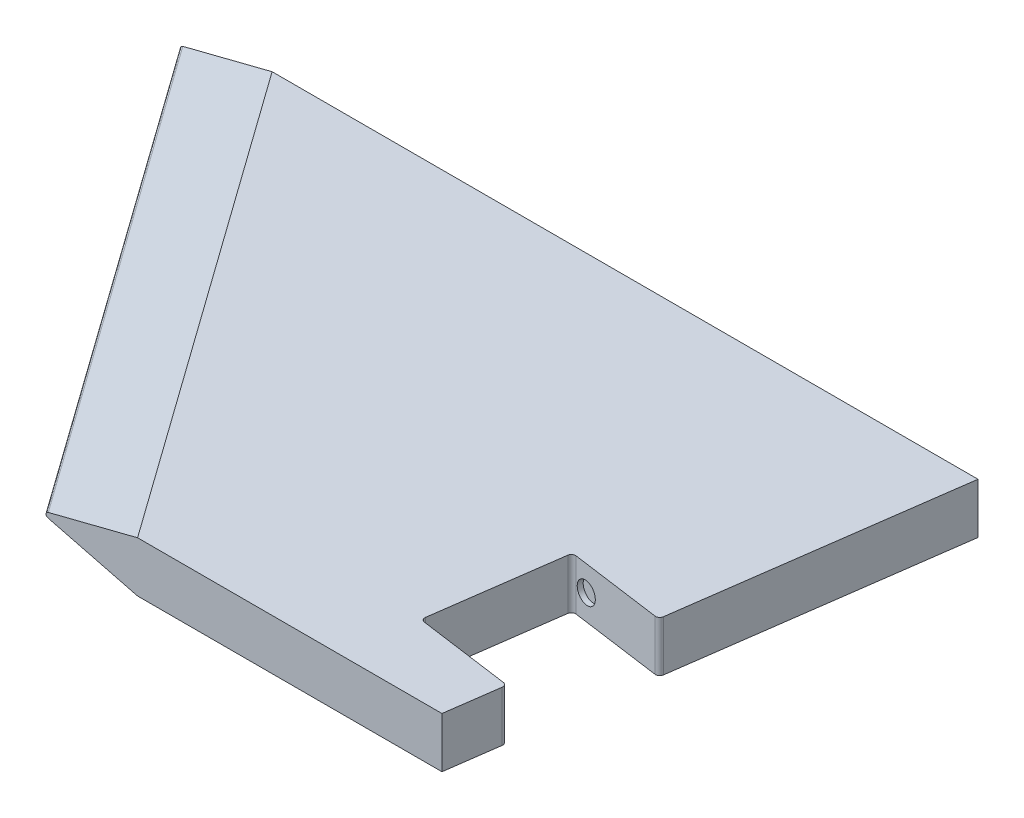
from build123d import *

# Parameters (mm, degrees)
BOSS_EXTRUDE1_DEPTH = 9.525
CUT_EXTRUDE11_DEPTH = 109.249530891
CUT_EXTRUDE12_DEPTH = 109.249530891
CUT_EXTRUDE1_DEPTH  = 164.459241155
FILLET25_R          = 0.79375
CUT_EXTRUDE8_DEPTH  = 7.112
FILLET31_R          = 0.79375
FILLET32_R          = 0.5
DELETEFACE2_START   = 2.413
DELETEFACE2_DEPTH   = 8.587
DELETEFACE2_2_DEPTH = 9.525
DELETEFACE3_START   = 2.413
DELETEFACE3_DEPTH   = 7.112
SKETCH42_R          = 2
CUT_EXTRUDE13_DEPTH = 1


with BuildPart() as part:
    # Sketch2 → Boss-Extrude1 (new body)
    with BuildSketch(Plane(origin=(0, 0, 0), x_dir=(1, 0, 0), z_dir=(0, 1, 0))):
        Polygon((95.501036211, 33.603610094), (107.801036211, 122.503610094), (-44.198963789, 122.503610094), (19.301036211, 33.603610094), align=None)
    extrude(amount=BOSS_EXTRUDE1_DEPTH)

    # Sketch40 → Cut-Extrude11 (cut, along a direction that is not the sketch's normal)
    with BuildSketch(Plane(origin=(0, 0, -122.503610094), x_dir=(-1, 0, 0), z_dir=(0, 0, -1))):
        Polygon((44.198963789, 4.7625), (25.464097027, 0), (44.198963789, 0), align=None)
    extrude(amount=-CUT_EXTRUDE11_DEPTH, dir=(-0.5812381937190961, 0, -0.8137334712067352), mode=Mode.SUBTRACT)

    # Sketch41 → Cut-Extrude12 (cut, along a direction that is not the sketch's normal)
    with BuildSketch(Plane(origin=(0, 0, -122.503610094), x_dir=(-1, 0, 0), z_dir=(0, 0, -1))):
        Polygon((44.198963789, 4.7625), (44.198963789, 9.525), (25.464097027, 9.525), align=None)
    extrude(amount=-CUT_EXTRUDE12_DEPTH, dir=(-0.5812381937190961, 0, -0.8137334712067352), mode=Mode.SUBTRACT)

    # Sketch3 → Cut-Extrude1 (cut, through all)
    with BuildSketch(Plane(origin=(0, 9.525, 0), x_dir=(1, 0, 0), z_dir=(0, 1, 0))):
        Polygon((96.991616373, 44.376990288), (78.121375316, 46.987833539), (81.602499651, 72.148154947), (100.472740707, 69.537311696), align=None)
    extrude(amount=-CUT_EXTRUDE1_DEPTH, mode=Mode.SUBTRACT)

    # Fillet25
    fillet25_edges = [part.edges().sort_by_distance(p)[0] for p in [
        (100.472740707, 4.7625, -69.537311696),
        (96.991616373, 4.7625, -44.376990288),
        (78.121375316, 4.7625, -46.987833539),
        (81.602499651, 4.7625, -72.148154947),
    ]]
    fillet(fillet25_edges, radius=FILLET25_R)

    # Sketch4 → Cut-Extrude8 (cut)
    with BuildSketch(Plane(origin=(0, 9.525, 0), x_dir=(1, 0, 0), z_dir=(0, 1, 0))):
        with BuildLine():
            Line((91.432981633, 84.938583056), (91.87398018, 88.3325177))
            ThreePointArc((91.87398018, 88.3325177), (91.880119161, 88.935768076), (91.743819438, 89.523450889))
            Line((91.743819438, 89.523450889), (84.365995583, 109.929022071))
            ThreePointArc((84.365995583, 109.929022071), (84.052194516, 110.530485922), (83.590381446, 111.027435178))
            Line((83.590381446, 111.027435178), (69.63117281, 122.503610094))
            Line((69.63117281, 122.503610094), (65.631546235, 122.503610094))
            Line((65.631546235, 122.503610094), (81.977330858, 109.065378145))
            Line((81.977330858, 109.065378145), (88.524922018, 90.956062972))
            ThreePointArc((88.524922018, 90.956062972), (86.871368444, 87.055321455), (82.635738177, 86.958058718))
            ThreePointArc((82.635738177, 86.958058718), (82.108570303, 87.435753172), (81.573856943, 87.904986143))
            ThreePointArc((81.573856943, 87.904986143), (80.279037974, 88.75135311), (78.792534366, 89.179372068))
            Line((78.792534366, 89.179372068), (71.259162002, 90.172380139))
            Line((71.259162002, 90.172380139), (70.399965305, 83.95114873))
            Line((70.399965305, 83.95114873), (68.995626594, 73.78267842))
            Line((68.995626594, 73.78267842), (81.599351809, 72.105893611))
            Line((81.599351809, 72.105893611), (81.450209567, 70.968016338))
            Line((81.450209567, 70.968016338), (82.559812791, 70.82309653))
            Line((82.559812791, 70.82309653), (82.351161676, 69.22552369))
            Line((82.351161676, 69.22552369), (86.280730255, 68.712302106))
            Line((86.280730255, 68.712302106), (86.63642856, 71.435766832))
            Line((86.63642856, 71.435766832), (89.626769646, 71.037935364))
            Line((89.626769646, 71.037935364), (91.432981633, 84.938583056))
        make_face()
    extrude(amount=-CUT_EXTRUDE8_DEPTH, mode=Mode.SUBTRACT)

    # Fillet31
    # the kernel refuses this fillet: 0.79375 mm, written as the material it adds along each edge
    with BuildSketch(Plane(origin=(71.259162002, 9.525, -90.172380139), x_dir=(0.9914240578116118, 0, 0.13068411377194142), z_dir=(0, -1, 0))) as fillet31_piece_1:
        with BuildLine():
            CenterArc((FILLET31_R * 0.993838975456, FILLET31_R), FILLET31_R, 180.35409036, 89.64590964)
            Line((-FILLET31_R * 0.00614192814136, FILLET31_R * 0.993819996707), (0, 0))
            Line((0, 0), (FILLET31_R * 0.993838975456, 0))
        make_face()
    extrude(amount=9.084149217)
    with BuildSketch(Plane(origin=(68.995626594, 9.525, -73.78267842), x_dir=(0.13680862211806724, 0, -0.9905974969250406), z_dir=(0, -1, 0))) as fillet31_piece_2:
        with BuildLine():
            CenterArc((FILLET31_R * 1.00498928997, FILLET31_R), FILLET31_R, 179.714846688, 90.285153312)
            Line((FILLET31_R * 0.00500167453449, FILLET31_R * 1.00497684362), (0, 0))
            Line((0, 0), (FILLET31_R * 1.00498928997, 0))
        make_face()
    extrude(amount=9.106275622)
    # the kernel refuses this fillet: 0.79375 mm, written as the material it takes off along each edge
    with BuildSketch(Plane(origin=(89.626769646, 11.493028645, -71.037935364), x_dir=(0.9905638349724125, 0, 0.13705213914692133), z_dir=(0, -1, 0))) as fillet31_2_piece_1:
        with BuildLine():
            CenterArc((FILLET31_R * 0.991762466743, -FILLET31_R), FILLET31_R, 90, 89.526074815)
            Line((-FILLET31_R * 0.00820332414174, -FILLET31_R * 0.991728539427), (0, 0))
            Line((0, 0), (FILLET31_R * 0.991762466743, 0))
        make_face()
    extrude(amount=9.080028645, mode=Mode.SUBTRACT)
    with BuildSketch(Plane(origin=(81.599351809, 11.470712134, -72.105893611), x_dir=(-0.99126610392599, 0, -0.1318768789719729), z_dir=(0, -1, 0))) as fillet31_2_piece_2:
        with BuildLine():
            CenterArc((0.778284853, -0.79375), FILLET31_R, 90, 79.138737607)
            Line((-0.001246175, -0.644182498), (0, 0))
            Line((0, 0), (0.778284853, 0))
        make_face()
    extrude(amount=9.057712134, mode=Mode.SUBTRACT)

    # Fillet32
    fillet32_edges = [part.edges().sort_by_distance(p)[0] for p in [
        (-12.448963789, 4.7625, -78.053610094),
    ]]
    fillet(fillet32_edges, radius=FILLET32_R)

    # DeleteFace2: read off the stored shape, not the designer's step
    # DeleteFace2 outline → DeleteFace2 (cut)
    with BuildSketch(Plane(origin=(0, 0, 0), x_dir=(1, 0, 0), z_dir=(0, 1, 0)).offset(DELETEFACE2_START)):
        with BuildLine():
            Line((71.259162002, 90.172380139), (71.151239195, 89.390937708))
            ThreePointArc((71.151239195, 89.390937708), (71.456370289, 89.91363683), (72.041256474, 90.06928871))
            Line((72.041256474, 90.06928871), (71.259162002, 90.172380139))
        make_face()
        with BuildLine():
            Line((68.995626594, 73.78267842), (69.786369725, 73.677478882))
            ThreePointArc((69.786369725, 73.677478882), (69.259466687, 73.983520547), (69.104760234, 74.572888196))
            Line((69.104760234, 74.572888196), (68.995626594, 73.78267842))
        make_face()
    extrude(amount=DELETEFACE2_DEPTH, mode=Mode.SUBTRACT)

    # DeleteFace2 2 outline → DeleteFace2 2 (add)
    with BuildSketch(Plane(origin=(0, 0, 0), x_dir=(1, 0, 0), z_dir=(0, 1, 0))):
        with BuildLine():
            ThreePointArc((80.827864414, 72.208531388), (81.305090173, 71.961554565), (81.515634323, 71.467172994))
            ThreePointArc((81.515634323, 71.467172994), (81.745680073, 71.840109312), (82.138550491, 72.034159252))
            Line((82.138550491, 72.034159252), (80.827864414, 72.208531388))
        make_face()
    extrude(amount=DELETEFACE2_2_DEPTH)

    # DeleteFace3: read off the stored shape, not the designer's step
    # DeleteFace3 outline → DeleteFace3 (add)
    with BuildSketch(Plane(origin=(0, 0, 0), x_dir=(1, 0, 0), z_dir=(0, 1, 0)).offset(DELETEFACE3_START)):
        with BuildLine():
            Line((82.388759695, 72.039369812), (90.406552846, 70.93004635))
            ThreePointArc((90.406552846, 70.93004635), (89.884432105, 71.234645894), (89.728205023, 71.818584289))
            Line((89.728205023, 71.818584289), (91.87398018, 88.3325177))
            ThreePointArc((91.87398018, 88.3325177), (91.880119161, 88.935768076), (91.743819438, 89.523450889))
            Line((91.743819438, 89.523450889), (84.365995583, 109.929022071))
            ThreePointArc((84.365995583, 109.929022071), (84.052194516, 110.530485922), (83.590381446, 111.027435178))
            Line((83.590381446, 111.027435178), (69.63117281, 122.503610094))
            Line((69.63117281, 122.503610094), (65.631546235, 122.503610094))
            Line((65.631546235, 122.503610094), (81.977330858, 109.065378145))
            Line((81.977330858, 109.065378145), (88.524922018, 90.956062972))
            ThreePointArc((88.524922018, 90.956062972), (86.871368444, 87.055321455), (82.635738177, 86.958058718))
            ThreePointArc((82.635738177, 86.958058718), (82.108570303, 87.435753172), (81.573856943, 87.904986143))
            ThreePointArc((81.573856943, 87.904986143), (80.279037974, 88.75135311), (78.792534366, 89.179372068))
            Line((78.792534366, 89.179372068), (71.259162002, 90.172380139))
            Line((71.259162002, 90.172380139), (68.995626594, 73.78267842))
            Line((68.995626594, 73.78267842), (82.138550491, 72.034159252))
            ThreePointArc((82.138550491, 72.034159252), (82.263448445, 72.04668771), (82.388759695, 72.039369812))
        make_face()
    extrude(amount=DELETEFACE3_DEPTH)

    # Sketch42 → Cut-Extrude13 (cut)
    with BuildSketch(Plane(origin=(11.327516936, 0, -81.871240295), x_dir=(0.9905638349724135, 0, 0.13705213914691416), z_dir=(-0.13705213914691416, 0, 0.9905638349724135))):
        with Locations((73.988256108, 4.7625)):
            Circle(SKETCH42_R)
    extrude(amount=-CUT_EXTRUDE13_DEPTH, mode=Mode.SUBTRACT)


solid = part.part
